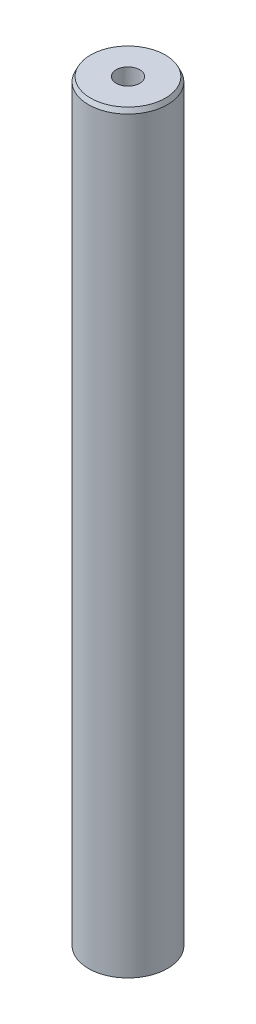
from build123d import *
from OCP.BRepFilletAPI import BRepFilletAPI_MakeChamfer

# Parameters (mm, degrees)
SKETCH1_R           = 12.5
BOSS_EXTRUDE1_DEPTH = 238.592045468
SKETCH2_R           = 3.726578701
CUT_EXTRUDE1_DEPTH  = 240.246032696
CHAMFER1_SIZE       = 1.445260422
CHAMFER1_SIZE2      = 0.677365396


with BuildPart() as part:
    # Sketch1 → Boss-Extrude1 (new body)
    with BuildSketch(Plane(origin=(0, 0, 0), x_dir=(1, 0, 0), z_dir=(0, 1, 0))):
        Circle(SKETCH1_R)
    extrude(amount=BOSS_EXTRUDE1_DEPTH)

    # Sketch2 → Cut-Extrude1 (cut, through all)
    with BuildSketch(Plane(origin=(0, 0, 0), x_dir=(1, 0, 0), z_dir=(0, 1, 0))):
        Circle(SKETCH2_R)
    extrude(amount=CUT_EXTRUDE1_DEPTH, mode=Mode.SUBTRACT)

    # Chamfer1: one chamfer whose edges measure the first distance from different faces: ONE call of the kernel's chamfer builder (chamfer() names one face for all edges)
    chamfer1_edges_1 = [part.edges().sort_by_distance(p)[0] for p in [
        (-12.5, 238.592045468, 0),
    ]]
    chamfer1_side_1 = [part.faces().sort_by_distance(p)[0] for p in [
        (-12.5, 119.296022734, 0),
    ]]
    chamfer1_edges_2 = [part.edges().sort_by_distance(p)[0] for p in [
        (-12.5, 0, 0),
    ]]
    chamfer1_side_2 = [part.faces().sort_by_distance(p)[0] for p in [
        (-12.146446609, 0, 0),
    ]]
    chamfer1 = BRepFilletAPI_MakeChamfer(part.part.solid().wrapped)
    for e in chamfer1_edges_1:
        chamfer1.Add(CHAMFER1_SIZE, CHAMFER1_SIZE2, e.wrapped, chamfer1_side_1[0].wrapped)  # the first distance lies on this face
    for e in chamfer1_edges_2:
        chamfer1.Add(CHAMFER1_SIZE, CHAMFER1_SIZE2, e.wrapped, chamfer1_side_2[0].wrapped)  # the first distance lies on this face
    add(Compound.cast(chamfer1.Shape()), mode=Mode.REPLACE)


solid = part.part
